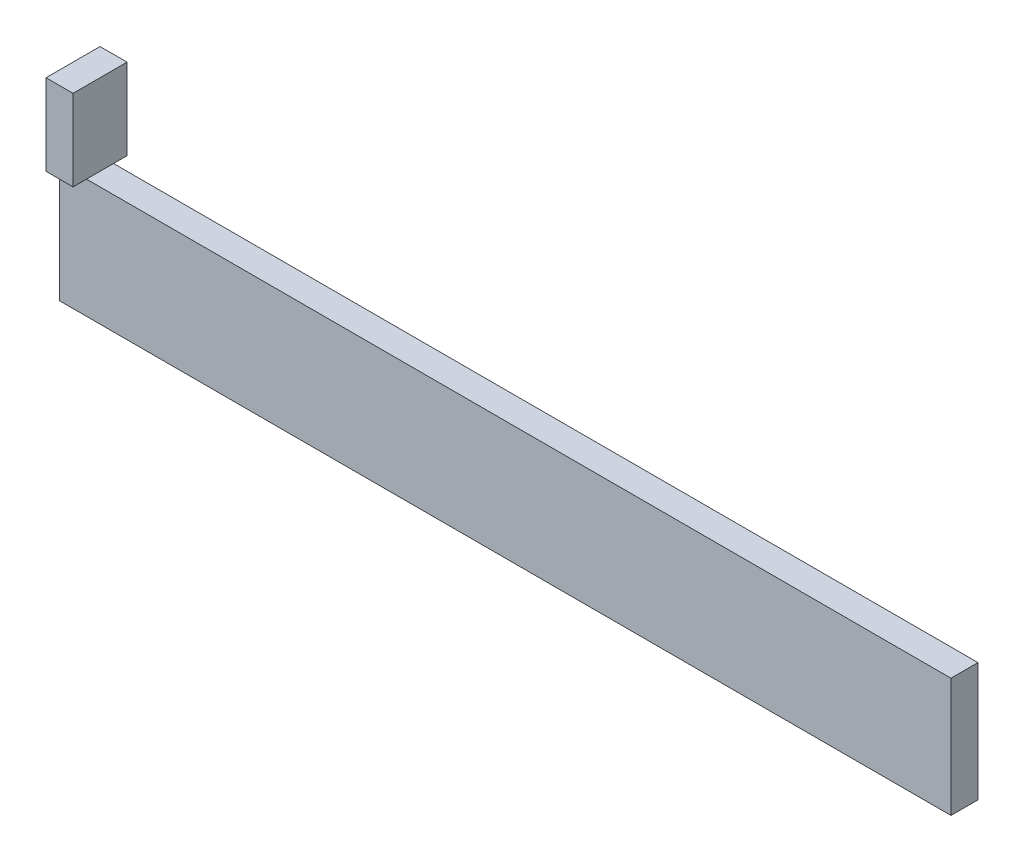
from build123d import *

# Parameters (mm, degrees)
SKETCH1_W           = 165
SKETCH1_H           = 22
BOSS_EXTRUDE1_DEPTH = 5
SKETCH2_W           = 10
SKETCH2_H           = 15
BOSS_EXTRUDE2_DEPTH = 5


with BuildPart() as part:
    # Sketch1 → Boss-Extrude1 (new body)
    with BuildSketch(Plane.XY):
        with Locations((82.5, 11)):
            Rectangle(SKETCH1_W, SKETCH1_H)
    extrude(amount=BOSS_EXTRUDE1_DEPTH)

    # Sketch2 → Boss-Extrude2 (add)
    with BuildSketch(Plane.ZY):
        with Locations((2.5, 29.5)):
            Rectangle(SKETCH2_W, SKETCH2_H)
    extrude(amount=-BOSS_EXTRUDE2_DEPTH)


solid = part.part
